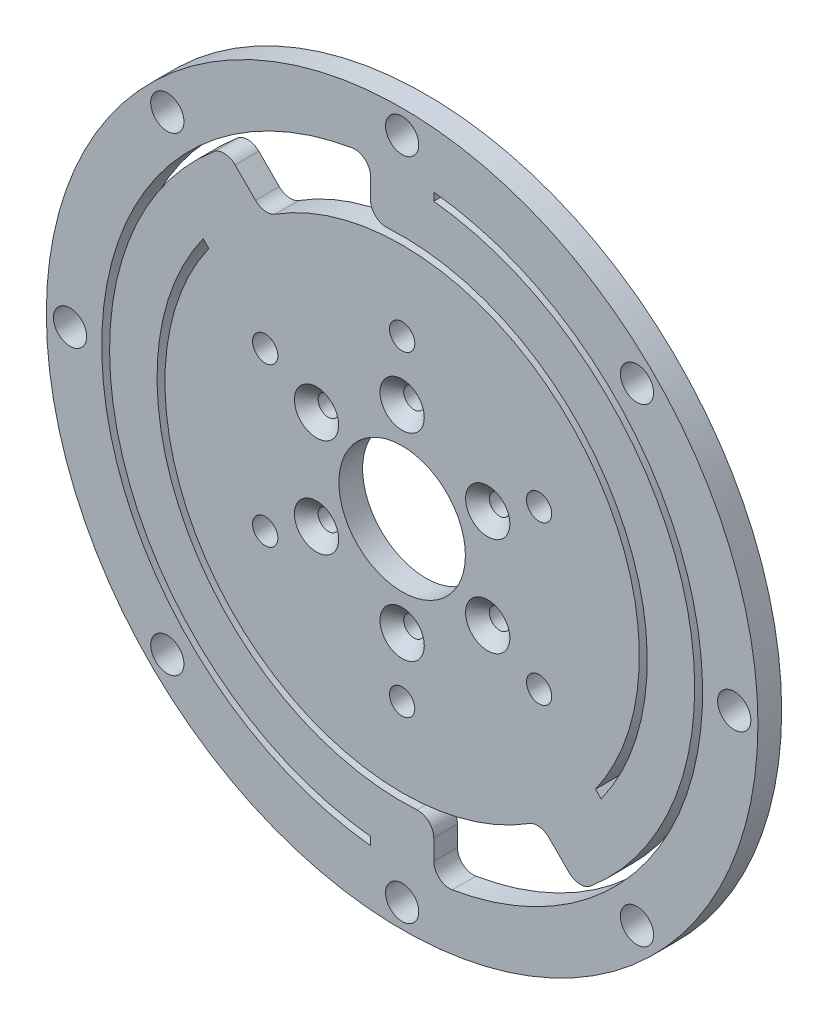
from build123d import *
from build123d.topology import SkipClean

# Parameters (mm, degrees)
EXTRUDE_1_OUTLINE_R      = 45
EXTRUDE_1_OUTLINE_R_2    = 2.1
EXTRUDE_1_OUTLINE_R_3    = 1.6
EXTRUDE_1_OUTLINE_R_4    = 1.3
EXTRUDE_1_OUTLINE_R_5    = 8
EXTRUDE_1_DEPTH          = 3
CUT_EXTRUDE_1_DEPTH      = 10
PATTERN_CIRCULAR_1_COUNT = 2
CUT_EXTRUDE_2_DEPTH      = 10
FILLET_1_R               = 2
CHAMFER_1_SIZE           = 1.5


# Read off the part's stored shape, not the designer's step: 凸台-拉伸1
with BuildPart() as part:
    # 凸台-拉伸1 outline → 凸台-拉伸1 (new body)
    with BuildSketch(Plane.XY):
        Circle(EXTRUDE_1_OUTLINE_R)
        with Locations((-29.69848481, -29.69848481)):
            Circle(EXTRUDE_1_OUTLINE_R_2, mode=Mode.SUBTRACT)
        with Locations((-17.320508076, -10)):
            Circle(EXTRUDE_1_OUTLINE_R_3, mode=Mode.SUBTRACT)
        with Locations((-10.825317547, -6.25)):
            Circle(EXTRUDE_1_OUTLINE_R_4, mode=Mode.SUBTRACT)
        with Locations((0, -42)):
            Circle(EXTRUDE_1_OUTLINE_R_2, mode=Mode.SUBTRACT)
        with Locations((29.69848481, -29.69848481)):
            Circle(EXTRUDE_1_OUTLINE_R_2, mode=Mode.SUBTRACT)
        with Locations((0, -20)):
            Circle(EXTRUDE_1_OUTLINE_R_3, mode=Mode.SUBTRACT)
        with Locations((0, -12.5)):
            Circle(EXTRUDE_1_OUTLINE_R_4, mode=Mode.SUBTRACT)
        with Locations((10.825317547, -6.25)):
            Circle(EXTRUDE_1_OUTLINE_R_4, mode=Mode.SUBTRACT)
        with Locations((17.320508076, -10)):
            Circle(EXTRUDE_1_OUTLINE_R_3, mode=Mode.SUBTRACT)
        with Locations((-42, 0)):
            Circle(EXTRUDE_1_OUTLINE_R_2, mode=Mode.SUBTRACT)
        with Locations((-17.320508076, 10)):
            Circle(EXTRUDE_1_OUTLINE_R_3, mode=Mode.SUBTRACT)
        with Locations((-10.825317547, 6.25)):
            Circle(EXTRUDE_1_OUTLINE_R_4, mode=Mode.SUBTRACT)
        with Locations((-29.69848481, 29.69848481)):
            Circle(EXTRUDE_1_OUTLINE_R_2, mode=Mode.SUBTRACT)
        Circle(EXTRUDE_1_OUTLINE_R_5, mode=Mode.SUBTRACT)
        with Locations((10.825317547, 6.25)):
            Circle(EXTRUDE_1_OUTLINE_R_4, mode=Mode.SUBTRACT)
        with Locations((17.320508076, 10)):
            Circle(EXTRUDE_1_OUTLINE_R_3, mode=Mode.SUBTRACT)
        with Locations((0, 12.5)):
            Circle(EXTRUDE_1_OUTLINE_R_4, mode=Mode.SUBTRACT)
        with Locations((0, 20)):
            Circle(EXTRUDE_1_OUTLINE_R_3, mode=Mode.SUBTRACT)
        with Locations((42, 0)):
            Circle(EXTRUDE_1_OUTLINE_R_2, mode=Mode.SUBTRACT)
        with Locations((0, 42)):
            Circle(EXTRUDE_1_OUTLINE_R_2, mode=Mode.SUBTRACT)
        with Locations((29.69848481, 29.69848481)):
            Circle(EXTRUDE_1_OUTLINE_R_2, mode=Mode.SUBTRACT)
    extrude(amount=EXTRUDE_1_DEPTH)

    # 草图2 → 切除-拉伸1 (cut)
    with BuildSketch(Plane.XY.offset(3)):
        with BuildLine():
            Line((4, 37.788887255), (4, 36.783148315))
            ThreePointArc((4, 36.783148315), (35.651970274, 9.896313233), (22.387428888, -29.4584967))
            Line((22.387428888, -29.4584967), (17.380966757, -24.452034569))
            ThreePointArc((17.380966757, -24.452034569), (16.963906124, -24.743198844), (16.541969004, -25.027250378))
            Line((16.541969004, -25.027250378), (22.290357636, -30.77563901))
            ThreePointArc((22.290357636, -30.77563901), (36.716063128, 9.794422308), (4, 37.788887255))
        make_face()
        with BuildLine():
            Line((-4, 37.788887255), (-4, 30.740852298))
            ThreePointArc((-4, 30.740852298), (26.614522572, 15.895508431), (25.168841559, -18.097773747))
            Line((25.168841559, -18.097773747), (24.452034569, -17.380966757))
            ThreePointArc((24.452034569, -17.380966757), (25.41530796, 15.93932625), (-5, 29.580398915))
            Line((-5, 29.580398915), (-5, 37.669616404))
            ThreePointArc((-5, 37.669616404), (-4.500395136, 37.732564763), (-4, 37.788887255))
        make_face()
    cut_extrude_1 = extrude(amount=-CUT_EXTRUDE_1_DEPTH, mode=Mode.SUBTRACT)

    # 阵列(圆周)1: 切除-拉伸1 ×2 about axis
    pattern_circular_1_axis = Axis((0, 0, 0), (0, 0, 1))
    for i in range(1, PATTERN_CIRCULAR_1_COUNT):
        add(cut_extrude_1.rotate(pattern_circular_1_axis, i * 360 / PATTERN_CIRCULAR_1_COUNT), mode=Mode.SUBTRACT)

    # 草图3 → 切除-拉伸2 (cut)
    with SkipClean():  # the faces are left unmerged after this step: merging them gives an invalid solid
        with BuildSketch(Plane.XY.offset(3)):
            with BuildLine():
                Line((-5, 37.669616404), (-5, 29.580398915))
                ThreePointArc((-5, 29.580398915), (-11.00894625, 27.907043958), (-16.541969004, 25.027250378))
                Line((-16.541969004, 25.027250378), (-22.290357636, 30.77563901))
                ThreePointArc((-22.290357636, 30.77563901), (-14.073828052, 35.297696298), (-5, 37.669616404))
            make_face()
            with BuildLine():
                Line((16.541969004, -25.027250378), (22.290357636, -30.77563901))
                ThreePointArc((22.290357636, -30.77563901), (14.073828052, -35.297696298), (5, -37.669616404))
                Line((5, -37.669616404), (5, -29.580398915))
                ThreePointArc((5, -29.580398915), (11.00894625, -27.907043958), (16.541969004, -25.027250378))
            make_face()
        extrude(amount=-CUT_EXTRUDE_2_DEPTH, mode=Mode.SUBTRACT)

    # 圆角1
    fillet_1_edges = [part.edges().sort_by_distance(p)[0] for p in [
        (-4, 37.788887255, 1.5),
        (-4, 30.740852298, 1.5),
        (17.380966757, -24.452034569, 1.5),
        (22.387428888, -29.4584967, 1.5),
        (4, -37.788887255, 1.5),
        (4, -30.740852298, 1.5),
        (-17.380966757, 24.452034569, 1.5),
        (-22.387428888, 29.4584967, 1.5),
    ]]
    fillet(fillet_1_edges, radius=FILLET_1_R)

    # 倒角1
    chamfer_1_edges = [part.edges().sort_by_distance(p)[0] for p in [
        (-1.3, 12.5, 3),
        (9.525317547, 6.25, 3),
        (9.525317547, -6.25, 3),
        (-1.3, -12.5, 3),
        (-12.125317547, -6.25, 3),
        (-12.125317547, 6.25, 3),
    ]]
    chamfer(chamfer_1_edges, length=CHAMFER_1_SIZE)


solid = part.part
